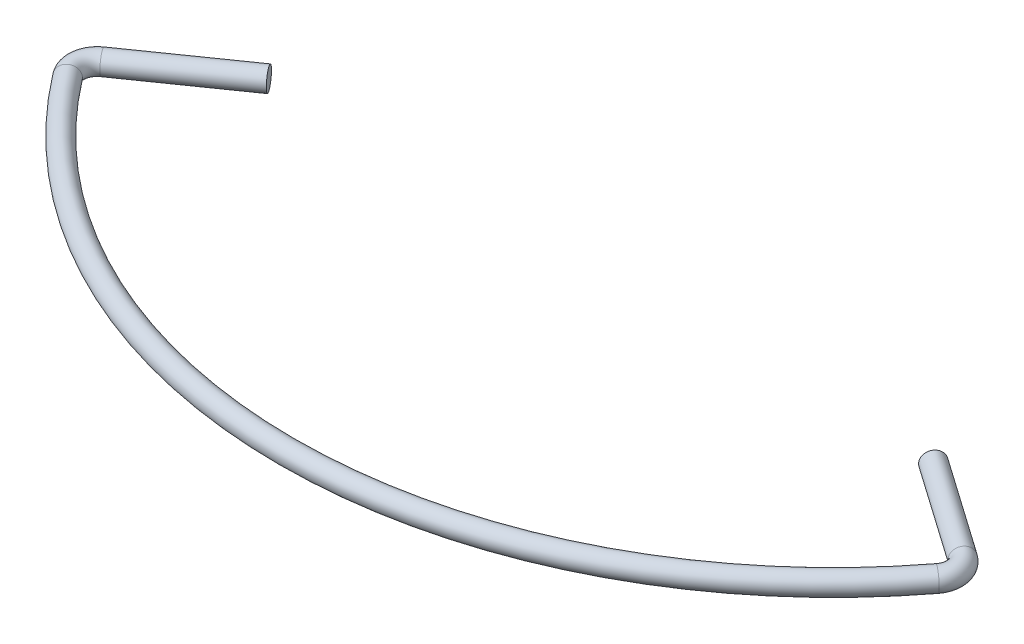
from build123d import *

# Parameters (mm, degrees)
LEFT_CROSS_SECTION_SKETCH_R   = 15
RIGHT_START                   = 100
RIGHT_CROSS_SECTION_SKETCH_R  = 15
RIGHT_JOINT_EXTRUDE_DEPTH     = 100
LEFT_CROSS_SECTION_SKETCH_2_R = 15
LEFT_JOINT_EXTRUDE_DEPTH      = 100


with BuildPart() as part:
    # Bar Sweep: sweep along a path in Overhead Sketch
    with BuildLine(Plane(origin=(0, 0, 0), x_dir=(1, 0, 0), z_dir=(0, 1, 0))) as bar_sweep_path:
        Line((552.927629895, -387.164094537), (609.773282426, -426.967848953))
        ThreePointArc((609.773282426, -426.967848953), (622.209139899, -446.928992387), (616.427707026, -469.725326132))
        ThreePointArc((616.427707026, -469.725326132), (0, -775), (-616.427707026, -469.725326132))
        ThreePointArc((-616.427707026, -469.725326132), (-622.209139899, -446.928992387), (-609.773282426, -426.967848953))
        Line((-609.773282426, -426.967848953), (-552.927629895, -387.164094537))
    # Left Cross Section Sketch → Bar Sweep (sweep)
    with BuildSketch(Plane(origin=(552.927629895, 0, 387.164094537), x_dir=(0.5735764363510444, 0, -0.8191520442889931), z_dir=(0.8191520442889931, 0, 0.5735764363510444))):
        Circle(LEFT_CROSS_SECTION_SKETCH_R)
    sweep(path=bar_sweep_path.line)

    # Right Cross Section Sketch → Right Joint Extrude (add)
    with BuildSketch(Plane(origin=(-552.927629895, 0, 387.164094537), x_dir=(-0.5735764363510407, 0, -0.8191520442889957), z_dir=(0.8191520442889956, 0, -0.5735764363510406)).offset(RIGHT_START)):
        Circle(RIGHT_CROSS_SECTION_SKETCH_R)
    extrude(amount=-RIGHT_JOINT_EXTRUDE_DEPTH)

    # Left Cross Section Sketch<2> → Left Joint Extrude (add)
    with BuildSketch(Plane(origin=(552.927629895, 0, 387.164094537), x_dir=(0.5735764363510444, 0, -0.8191520442889931), z_dir=(0.8191520442889931, 0, 0.5735764363510444))):
        Circle(LEFT_CROSS_SECTION_SKETCH_2_R)
    extrude(amount=-LEFT_JOINT_EXTRUDE_DEPTH)


solid = part.part
